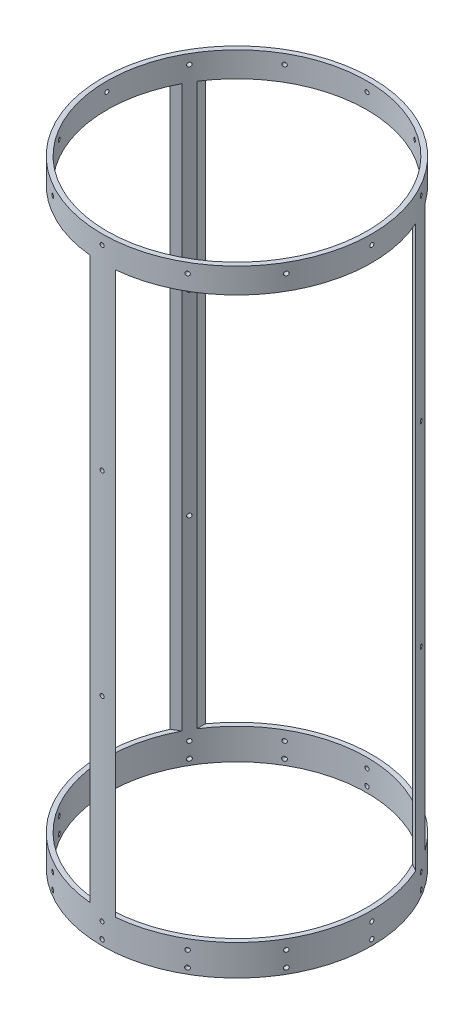
from build123d import *

# Parameters (mm, degrees)
SKETCH1_R               = 88.9
SKETCH1_R_2             = 85.725
BOSS_EXTRUDE1_DEPTH     = 203.2
CUT_EXTRUDE1_REACH      = 240.949
CUT_EXTRUDE1_END_RADIUS = 88.9
SKETCH2_W               = 144.78
SKETCH2_H               = 369.57
CIRPATTERN1_COUNT       = 3
SKETCH3_R               = 1.4351
SKETCH3_R_2             = 1.35255
CUT_EXTRUDE2_DEPTH      = 15.24
CIRPATTERN2_COUNT       = 12
SKETCH4_R               = 1.35255
CUT_EXTRUDE3_DEPTH      = 15.24
CIRPATTERN3_COUNT       = 12
SKETCH5_R               = 1.35255
CUT_EXTRUDE4_DEPTH      = 35.56
CIRPATTERN4_COUNT       = 3


with BuildPart() as part:
    # Sketch1 → Boss-Extrude1 (new, symmetric)
    with BuildSketch(Plane(origin=(0, 0, 0), x_dir=(1, 0, 0), z_dir=(0, 1, 0))):
        Circle(SKETCH1_R)
        Circle(SKETCH1_R_2, mode=Mode.SUBTRACT)
    extrude(amount=BOSS_EXTRUDE1_DEPTH, both=True)

    # Cut-Extrude1: up to this cylinder (the profile starts inside it)
    cut_extrude1_end = Plane(origin=(0, 1.905, 0), z_dir=(0, -1, 0)) * Cylinder(CUT_EXTRUDE1_END_RADIUS, 660.698, mode=Mode.PRIVATE)
    # Sketch2 → Cut-Extrude1 (cut, up to the surface)
    with BuildSketch(Plane.XY, mode=Mode.PRIVATE) as cut_extrude1_sk1:
        with Locations((0, 1.905)):
            Rectangle(SKETCH2_W, SKETCH2_H)
    cut_extrude1_tool1 = extrude(cut_extrude1_sk1.sketch, amount=-CUT_EXTRUDE1_REACH, mode=Mode.PRIVATE) & cut_extrude1_end
    cut_extrude1 = cut_extrude1_tool1.solids().sort_by_distance((0, 1.905, 0))[0]
    add(cut_extrude1, mode=Mode.SUBTRACT)

    # CirPattern1: Cut-Extrude1 ×3 about axis
    cirpattern1_axis = Axis((0, 203.2, 0), (0, -1, 0))
    for i in range(1, CIRPATTERN1_COUNT):
        add(cut_extrude1.rotate(cirpattern1_axis, i * 360 / CIRPATTERN1_COUNT), mode=Mode.SUBTRACT)

    # Sketch3 → Cut-Extrude2 (cut)
    with BuildSketch(Plane(origin=(88.9, 0, 0), x_dir=(0, 0, -1), z_dir=(1, 0, 0))):
        with Locations((0, -199.39)):
            Circle(SKETCH3_R)
        with Locations((0, -189.23)):
            Circle(SKETCH3_R_2)
    cut_extrude2 = extrude(amount=-CUT_EXTRUDE2_DEPTH, mode=Mode.SUBTRACT)

    # CirPattern2: Cut-Extrude2 ×12 about axis
    cirpattern2_axis = Axis((0, 203.2, 0), (0, -1, 0))
    for i in range(1, CIRPATTERN2_COUNT):
        add(cut_extrude2.rotate(cirpattern2_axis, i * 360 / CIRPATTERN2_COUNT), mode=Mode.SUBTRACT)

    # Sketch4 → Cut-Extrude3 (cut)
    with BuildSketch(Plane(origin=(88.9, 0, 0), x_dir=(0, 0, -1), z_dir=(1, 0, 0))):
        with Locations((0, 196.85)):
            Circle(SKETCH4_R)
    cut_extrude3 = extrude(amount=-CUT_EXTRUDE3_DEPTH, mode=Mode.SUBTRACT)

    # CirPattern3: Cut-Extrude3 ×12 about axis
    cirpattern3_axis = Axis((0, 203.2, 0), (0, -1, 0))
    for i in range(1, CIRPATTERN3_COUNT):
        add(cut_extrude3.rotate(cirpattern3_axis, i * 360 / CIRPATTERN3_COUNT), mode=Mode.SUBTRACT)

    # Sketch5 → Cut-Extrude4 (cut)
    with BuildSketch(Plane.XY.offset(88.9)):
        with Locations((0, 68.1736)):
            Circle(SKETCH5_R)
        with Locations((0, -60.5536)):
            Circle(SKETCH5_R)
    cut_extrude4 = extrude(amount=-CUT_EXTRUDE4_DEPTH, mode=Mode.SUBTRACT)

    # CirPattern4: Cut-Extrude4 ×3 about axis
    cirpattern4_axis = Axis((0, 203.2, 0), (0, -1, 0))
    for i in range(1, CIRPATTERN4_COUNT):
        add(cut_extrude4.rotate(cirpattern4_axis, i * 360 / CIRPATTERN4_COUNT), mode=Mode.SUBTRACT)


solid = part.part
